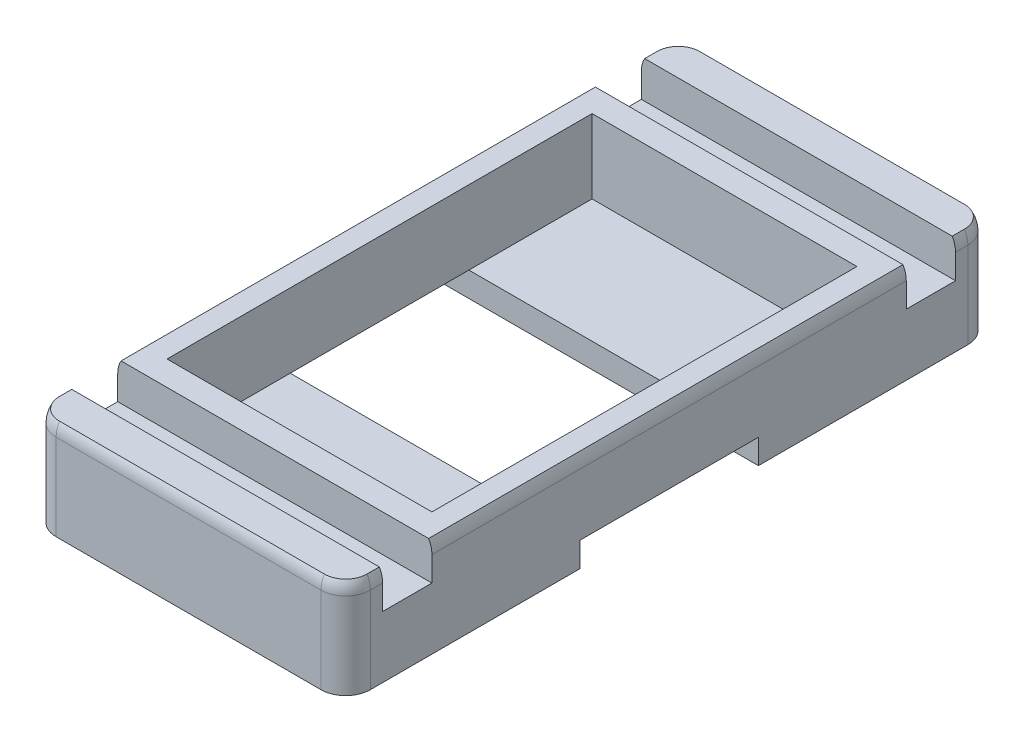
from build123d import *

# Parameters (mm, degrees)
SKETCH_1_W          = 21.5
SKETCH_1_H          = 34.5
EXTRUDE_2_DEPTH     = 11
FILLET_1_R          = 2
SKETCH_2_W          = 39.173485157
SKETCH_2_H          = 57.857292793
CUT_EXTRUDE_1_DEPTH = 1
SKETCH_3_W          = 21.5
SKETCH_3_H          = 10
EXTRUDE_3_DEPTH     = 3
SKETCH_4_W          = 36.577122412
SKETCH_4_H          = 60.487116615
CUT_EXTRUDE_2_DEPTH = 1
SKETCH_5_W          = 14.5
SKETCH_5_H          = 3
CUT_EXTRUDE_3_DEPTH = 11
SKETCH_6_W          = 14.5
SKETCH_6_H          = 3
CUT_EXTRUDE_4_DEPTH = 11
SKETCH_7_W          = 57.52189795
SKETCH_7_H          = 59.987072635
CUT_EXTRUDE_5_DEPTH = 1
SKETCH_8_W          = 21.5
SKETCH_8_H          = 34.5
EXTRUDE_4_DEPTH     = 1
FILLET_2_R          = 2
SKETCH_9_W          = 42.225742073
SKETCH_9_H          = 59.055369136
CUT_EXTRUDE_6_DEPTH = 1
SKETCH_10_W         = 4
SKETCH_10_H         = 2
SKETCH_10_H_2       = 3.79495429
CUT_EXTRUDE_8_DEPTH = 30
CUT_EXTRUDE_9_DEPTH = 30


with BuildPart() as part:
    # 草图1 → 凸台-拉伸2 (new body)
    with BuildSketch(Plane(origin=(0, 0, 0), x_dir=(1, 0, 0), z_dir=(0, 1, 0))):
        with BuildLine():
            Line((-13.732977682, 21.876274057), (7.767022318, 21.876274057))
            ThreePointArc((7.767022318, 21.876274057), (9.18123588, 21.290487619), (9.767022318, 19.876274057))
            Line((9.767022318, 19.876274057), (9.767022318, -28.623725943))
            ThreePointArc((9.767022318, -28.623725943), (9.18123588, -30.037939506), (7.767022318, -30.623725943))
            Line((7.767022318, -30.623725943), (-13.732977682, -30.623725943))
            ThreePointArc((-13.732977682, -30.623725943), (-15.147191244, -30.037939506), (-15.732977682, -28.623725943))
            Line((-15.732977682, -28.623725943), (-15.732977682, 19.876274057))
            ThreePointArc((-15.732977682, 19.876274057), (-15.147191244, 21.290487619), (-13.732977682, 21.876274057))
        make_face()
        with Locations((-2.982977682, -4.373725943)):
            Rectangle(SKETCH_1_W, SKETCH_1_H, mode=Mode.SUBTRACT)
    extrude(amount=EXTRUDE_2_DEPTH)

    # 圆角1
    fillet_1_edges = [part.edges().sort_by_distance(p)[0] for p in [
        (-15.147191244, 11, -21.290487619),
        (-15.732977682, 11, 4.373725943),
        (-15.147191244, 11, 30.037939506),
        (-2.982977682, 11, 30.623725943),
        (9.18123588, 11, 30.037939506),
        (9.767022318, 11, 4.373725943),
        (9.18123588, 11, -21.290487619),
        (-2.982977682, 11, -21.876274057),
    ]]
    fillet(fillet_1_edges, radius=FILLET_1_R - 0.0001)  # a hair under: the kernel refuses the full size

    # 草图2 → 切除-拉伸1 (cut)
    with BuildSketch(Plane(origin=(0, 11, 0), x_dir=(1, 0, 0), z_dir=(0, 1, 0))):
        with Locations((-2.456788303, -4.185742432)):
            Rectangle(SKETCH_2_W, SKETCH_2_H)
    extrude(amount=-CUT_EXTRUDE_1_DEPTH, mode=Mode.SUBTRACT)

    # 草图3 → 凸台-拉伸3 (add)
    with BuildSketch(Plane(origin=(0, 0, 0), x_dir=(-1, 0, 0), z_dir=(0, -1, 0))):
        with Locations((2.982977682, -16.623725943)):
            Rectangle(SKETCH_3_W, SKETCH_3_H)
        with Locations((2.982977682, 7.876274057)):
            Rectangle(SKETCH_3_W, SKETCH_3_H)
    extrude(amount=-EXTRUDE_3_DEPTH)

    # 草图4 → 切除-拉伸2 (cut)
    with BuildSketch(Plane(origin=(0, 10, 0), x_dir=(1, 0, 0), z_dir=(0, 1, 0))):
        with Locations((-2.114714468, -5.96144712)):
            Rectangle(SKETCH_4_W, SKETCH_4_H)
    extrude(amount=-CUT_EXTRUDE_2_DEPTH, mode=Mode.SUBTRACT)

    # 草图5 → 切除-拉伸3 (cut)
    with BuildSketch(Plane(origin=(-13.732977682, 0, 0), x_dir=(0, 0, -1), z_dir=(1, 0, 0))):
        with Locations((-4.373725943, 1.5)):
            Rectangle(SKETCH_5_W, SKETCH_5_H)
    extrude(amount=-CUT_EXTRUDE_3_DEPTH, mode=Mode.SUBTRACT)

    # 草图6 → 切除-拉伸4 (cut)
    with BuildSketch(Plane.ZY.offset(-7.767022318)):
        with Locations((4.373725943, 1.5)):
            Rectangle(SKETCH_6_W, SKETCH_6_H)
    extrude(amount=-CUT_EXTRUDE_4_DEPTH, mode=Mode.SUBTRACT)

    # 草图7 → 切除-拉伸5 (cut)
    with BuildSketch(Plane(origin=(0, 0, 0), x_dir=(-1, 0, 0), z_dir=(0, -1, 0))):
        with Locations((4.496549364, -6.319684839)):
            Rectangle(SKETCH_7_W, SKETCH_7_H)
    extrude(amount=-CUT_EXTRUDE_5_DEPTH, mode=Mode.SUBTRACT)

    # 草图8 → 凸台-拉伸4 (add)
    with BuildSketch(Plane(origin=(0, 9, 0), x_dir=(1, 0, 0), z_dir=(0, 1, 0))):
        with BuildLine():
            Line((9.767022318, -28.623725943), (9.767022318, 19.876274057))
            ThreePointArc((9.767022318, 19.876274057), (9.18123588, 21.290487619), (7.767022318, 21.876274057))
            Line((7.767022318, 21.876274057), (-13.732977682, 21.876274057))
            ThreePointArc((-13.732977682, 21.876274057), (-15.147191244, 21.290487619), (-15.732977682, 19.876274057))
            Line((-15.732977682, 19.876274057), (-15.732977682, -28.623725943))
            ThreePointArc((-15.732977682, -28.623725943), (-15.147191244, -30.037939506), (-13.732977682, -30.623725943))
            Line((-13.732977682, -30.623725943), (7.767022318, -30.623725943))
            ThreePointArc((7.767022318, -30.623725943), (9.18123588, -30.037939506), (9.767022318, -28.623725943))
        make_face()
        with Locations((-2.982977682, -4.373725943)):
            Rectangle(SKETCH_8_W, SKETCH_8_H, mode=Mode.SUBTRACT)
    extrude(amount=EXTRUDE_4_DEPTH)

    # 圆角2
    fillet_2_edges = [part.edges().sort_by_distance(p)[0] for p in [
        (9.767022318, 10, 4.373725943),
        (9.18123588, 10, -21.290487619),
        (-2.982977682, 10, -21.876274057),
        (-15.147191244, 10, -21.290487619),
        (-15.732977682, 10, 4.373725943),
        (-15.147191244, 10, 30.037939506),
        (-2.982977682, 10, 30.623725943),
        (9.18123588, 10, 30.037939506),
    ]]
    fillet(fillet_2_edges, radius=FILLET_2_R - 0.0001)  # a hair under: the kernel refuses the full size

    # 草图9 → 切除-拉伸6 (cut)
    with BuildSketch(Plane(origin=(0, 10, 0), x_dir=(1, 0, 0), z_dir=(0, 1, 0))):
        with Locations((1.20063142, -3.725323224)):
            Rectangle(SKETCH_9_W, SKETCH_9_H)
    extrude(amount=-CUT_EXTRUDE_6_DEPTH, mode=Mode.SUBTRACT)

    # 草图10 → 切除-拉伸8 (cut)
    with BuildSketch(Plane.ZY.offset(15.732977682)):
        with Locations((-16.876274057, 7)):
            Rectangle(SKETCH_10_W, SKETCH_10_H)
        with Locations((-16.876274057, 9.897477145)):
            Rectangle(SKETCH_10_W, SKETCH_10_H_2)
    extrude(amount=-CUT_EXTRUDE_8_DEPTH, mode=Mode.SUBTRACT)

    # 草图11 → 切除-拉伸9 (cut)
    with BuildSketch(Plane.ZY.offset(15.732977682)):
        Polygon((23.623725943, 8), (23.623725943, 14.233861669), (27.623725943, 14.233861669), (27.623725943, 8), (27.623725943, 6), (23.623725943, 6), align=None)
    extrude(amount=-CUT_EXTRUDE_9_DEPTH, mode=Mode.SUBTRACT)


solid = part.part
